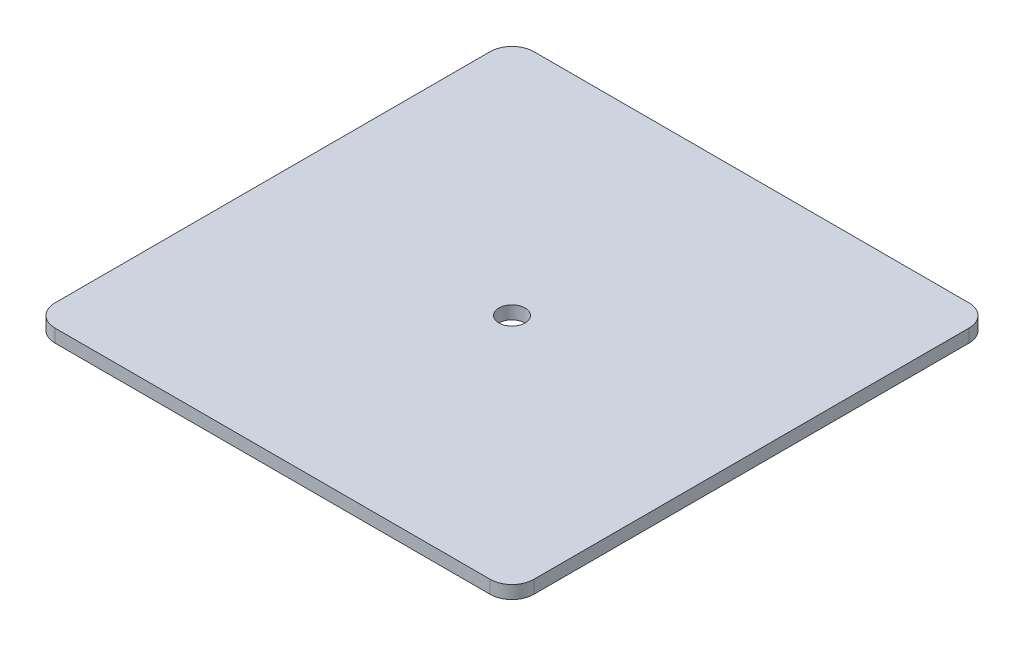
from build123d import *

# Parameters (mm, degrees)
SKETCH1_W           = 220
SKETCH1_H           = 220
BOSS_EXTRUDE1_DEPTH = 6
SKETCH2_R           = 6
CUT_EXTRUDE1_DEPTH  = 51
FILLET1_R           = 10


with BuildPart() as part:
    # Sketch1 → Boss-Extrude1 (new body)
    with BuildSketch(Plane(origin=(0, 0, 0), x_dir=(1, 0, 0), z_dir=(0, 1, 0))):
        Rectangle(SKETCH1_W, SKETCH1_H)
    extrude(amount=BOSS_EXTRUDE1_DEPTH)

    # Sketch2 → Cut-Extrude1 (cut)
    with BuildSketch(Plane(origin=(0, 6, 0), x_dir=(1, 0, 0), z_dir=(0, 1, 0))):
        Circle(SKETCH2_R)
    extrude(amount=-CUT_EXTRUDE1_DEPTH, mode=Mode.SUBTRACT)

    # Fillet1
    fillet1_edges = [part.edges().sort_by_distance(p)[0] for p in [
        (-110, 3, -110),
        (-110, 3, 110),
        (110, 3, -110),
        (110, 3, 110),
    ]]
    fillet(fillet1_edges, radius=FILLET1_R)


solid = part.part
